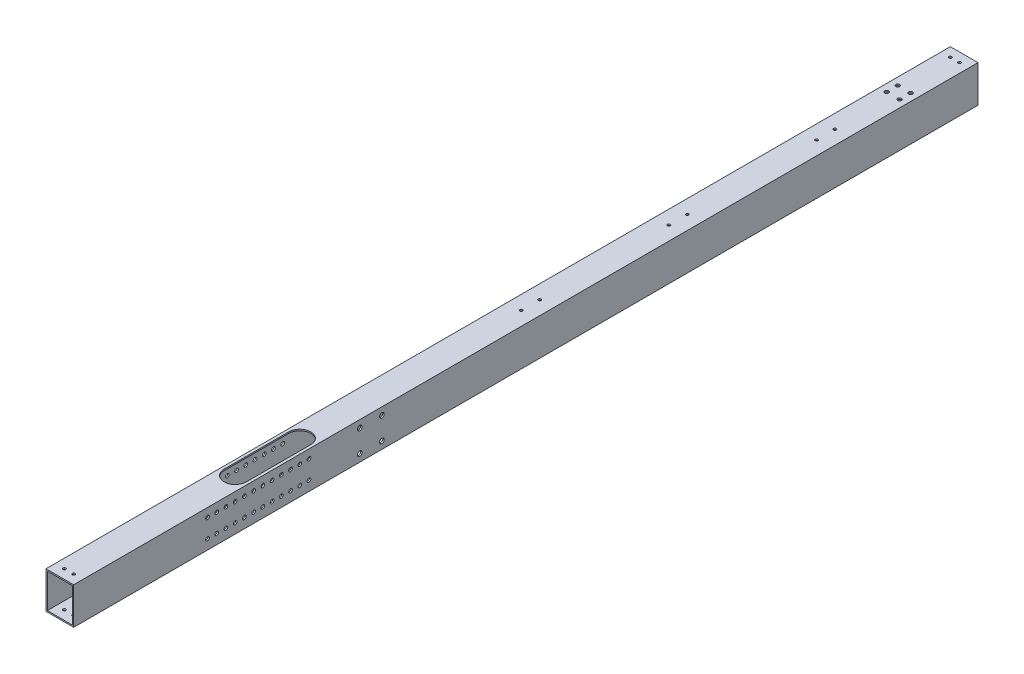
from build123d import *

# Parameters (mm, degrees)
SKETCH_1_W             = 30
SKETCH_1_H             = 40
SKETCH_1_W_2           = 27
SKETCH_1_H_2           = 37
EXTRUDE_1_DEPTH        = 980
SKETCH_3_R             = 1.5
CUT_EXTRUDE_2_DEPTH    = 981.930680527
SKETCH_4_R             = 3.25
CUT_EXTRUDE_3_DEPTH    = 21
SKETCH_5_R             = 1.5
CUT_EXTRUDE_4_DEPTH    = 981.930680527
CUT_EXTRUDE_6_DEPTH    = 10
SKETCH_9_R             = 1.6
CUT_EXTRUDE_7_DEPTH    = 10
PATTERN_LINEAR_1_COUNT = 4
PATTERN_LINEAR_1_PITCH = 13
SKETCH_10_R            = 2.55
CUT_EXTRUDE_8_DEPTH    = 51
SKETCH_11_R            = 2
CUT_EXTRUDE_9_DEPTH    = 51
SKETCH_12_R            = 2.1
CUT_EXTRUDE_10_DEPTH   = 10
CUT_EXTRUDE_11_DEPTH   = 10
CUT_EXTRUDE_12_DEPTH   = 10


with BuildPart() as part:
    # 草图1 → 凸台-拉伸1 (new body)
    with BuildSketch(Plane.XY):
        Rectangle(SKETCH_1_W, SKETCH_1_H)
        Rectangle(SKETCH_1_W_2, SKETCH_1_H_2, mode=Mode.SUBTRACT)
    extrude(amount=EXTRUDE_1_DEPTH)

    # 草图3 → 切除-拉伸2 (cut, through all)
    with BuildSketch(Plane(origin=(0, 20, 0), x_dir=(-1, 0, 0), z_dir=(0, -1, 0))):
        with Locations((5, -10)):
            Circle(SKETCH_3_R)
        with Locations((-5, -10)):
            Circle(SKETCH_3_R)
        with Locations((-5, -970)):
            Circle(SKETCH_3_R)
        with Locations((5, -970)):
            Circle(SKETCH_3_R)
    extrude(amount=CUT_EXTRUDE_2_DEPTH, mode=Mode.SUBTRACT)

    # 草图4 → 切除-拉伸3 (cut)
    with BuildSketch(Plane(origin=(0, 20, 0), x_dir=(-1, 0, 0), z_dir=(0, -1, 0))):
        with Locations((-8.27006126, -772.5)):
            Circle(SKETCH_4_R)
        with Locations((6.72993874, -772.5)):
            Circle(SKETCH_4_R)
        with Locations((6.72993874, -787.5)):
            Circle(SKETCH_4_R)
        with Locations((-8.27006126, -787.5)):
            Circle(SKETCH_4_R)
    extrude(amount=CUT_EXTRUDE_3_DEPTH, mode=Mode.SUBTRACT)

    # 草图5 → 切除-拉伸4 (cut, through all)
    with BuildSketch(Plane(origin=(0, 20, 0), x_dir=(-1, 0, 0), z_dir=(0, -1, 0))):
        with Locations((0, -140)):
            Circle(SKETCH_5_R)
        with Locations((0, -160)):
            Circle(SKETCH_5_R)
        with Locations((0, -300)):
            Circle(SKETCH_5_R)
        with Locations((0, -320)):
            Circle(SKETCH_5_R)
        with Locations((0, -480)):
            Circle(SKETCH_5_R)
        with Locations((0, -460)):
            Circle(SKETCH_5_R)
    extrude(amount=CUT_EXTRUDE_4_DEPTH, mode=Mode.SUBTRACT)

    # 草图8 → 切除-拉伸6 (cut)
    with BuildSketch(Plane.XZ.offset(20)):
        with BuildLine():
            Line((7.5, 160), (7.5, 140))
            ThreePointArc((7.5, 140), (0, 132.5), (-7.5, 140))
            Line((-7.5, 140), (-7.5, 160))
            ThreePointArc((-7.5, 160), (0, 167.5), (7.5, 160))
        make_face()
        with BuildLine():
            Line((7.5, 480), (7.5, 460))
            ThreePointArc((7.5, 460), (0, 452.5), (-7.5, 460))
            Line((-7.5, 460), (-7.5, 480))
            ThreePointArc((-7.5, 480), (0, 487.5), (7.5, 480))
        make_face()
        with BuildLine():
            Line((7.5, 320), (7.5, 300))
            ThreePointArc((7.5, 300), (0, 292.5), (-7.5, 300))
            Line((-7.5, 300), (-7.5, 320))
            ThreePointArc((-7.5, 320), (0, 327.5), (7.5, 320))
        make_face()
    extrude(amount=-CUT_EXTRUDE_6_DEPTH, mode=Mode.SUBTRACT)

    # 草图9 → 切除-拉伸7 (cut)
    with BuildSketch(Plane.XZ.offset(20)):
        with Locations((10, 787.5)):
            Circle(SKETCH_9_R)
        with Locations((10, 774.5)):
            Circle(SKETCH_9_R)
        with Locations((-10, 774.5)):
            Circle(SKETCH_9_R)
        with Locations((-10, 787.5)):
            Circle(SKETCH_9_R)
    cut_extrude_7 = extrude(amount=-CUT_EXTRUDE_7_DEPTH, mode=Mode.SUBTRACT)

    # 阵列(线性)1: 切除-拉伸7 ×4
    with Locations(*[(0, 0, -i * PATTERN_LINEAR_1_PITCH) for i in range(1, PATTERN_LINEAR_1_COUNT)]):
        add(cut_extrude_7, mode=Mode.SUBTRACT)

    # 草图10 → 切除-拉伸8 (cut)
    with BuildSketch(Plane.ZY.offset(15)):
        with Locations((646, 12)):
            Circle(SKETCH_10_R)
        with Locations((670, 12)):
            Circle(SKETCH_10_R)
        with Locations((646, -12)):
            Circle(SKETCH_10_R)
        with Locations((670, -12)):
            Circle(SKETCH_10_R)
    extrude(amount=-CUT_EXTRUDE_8_DEPTH, mode=Mode.SUBTRACT)

    # 草图11 → 切除-拉伸9 (cut)
    with BuildSketch(Plane.ZY.offset(15)):
        with Locations((725, 10.625214933)):
            Circle(SKETCH_11_R)
        with Locations((725, -9.374785067)):
            Circle(SKETCH_11_R)
        with Locations((735, 10.625214933)):
            Circle(SKETCH_11_R)
        with Locations((735, -9.374785067)):
            Circle(SKETCH_11_R)
        with Locations((745, 10.625214933)):
            Circle(SKETCH_11_R)
        with Locations((745, -9.374785067)):
            Circle(SKETCH_11_R)
        with Locations((755, 10.625214933)):
            Circle(SKETCH_11_R)
        with Locations((755, -9.374785067)):
            Circle(SKETCH_11_R)
        with Locations((765, 10.625214933)):
            Circle(SKETCH_11_R)
        with Locations((765, -9.374785067)):
            Circle(SKETCH_11_R)
        with Locations((775, 10.625214933)):
            Circle(SKETCH_11_R)
        with Locations((775, -9.374785067)):
            Circle(SKETCH_11_R)
        with Locations((785, 10.625214933)):
            Circle(SKETCH_11_R)
        with Locations((785, -9.374785067)):
            Circle(SKETCH_11_R)
        with Locations((795, 10.625214933)):
            Circle(SKETCH_11_R)
        with Locations((795, -9.374785067)):
            Circle(SKETCH_11_R)
        with Locations((805, 10.625214933)):
            Circle(SKETCH_11_R)
        with Locations((805, -9.374785067)):
            Circle(SKETCH_11_R)
        with Locations((815, 10.625214933)):
            Circle(SKETCH_11_R)
        with Locations((815, -9.374785067)):
            Circle(SKETCH_11_R)
        with Locations((825, 10.625214933)):
            Circle(SKETCH_11_R)
        with Locations((825, -9.374785067)):
            Circle(SKETCH_11_R)
        with Locations((835, 10.625214933)):
            Circle(SKETCH_11_R)
        with Locations((835, -9.374785067)):
            Circle(SKETCH_11_R)
    extrude(amount=-CUT_EXTRUDE_9_DEPTH, mode=Mode.SUBTRACT)

    # 草图12 → 切除-拉伸10 (cut)
    with BuildSketch(Plane(origin=(0, 20, 0), x_dir=(1, 0, 0), z_dir=(0, 1, 0))):
        with Locations((-7, -65)):
            Circle(SKETCH_12_R)
        with Locations((-7, -77)):
            Circle(SKETCH_12_R)
        with Locations((7, -77)):
            Circle(SKETCH_12_R)
        with Locations((7, -65)):
            Circle(SKETCH_12_R)
    extrude(amount=-CUT_EXTRUDE_10_DEPTH, mode=Mode.SUBTRACT)

    # 草图13 → 切除-拉伸11 (cut)
    with BuildSketch(Plane.XZ.offset(20)):
        with BuildLine():
            Line((-8.20885401, 70.140843723), (-8.20885401, 99.712723414))
            ThreePointArc((-8.20885401, 99.712723414), (0, 107.921577424), (8.20885401, 99.712723414))
            Line((8.20885401, 99.712723414), (8.20885401, 70.140843723))
            ThreePointArc((8.20885401, 70.140843723), (0, 61.931989713), (-8.20885401, 70.140843723))
        make_face()
    extrude(amount=-CUT_EXTRUDE_11_DEPTH, mode=Mode.SUBTRACT)

    # 草图14 → 切除-拉伸12 (cut)
    with BuildSketch(Plane(origin=(0, 20, 0), x_dir=(1, 0, 0), z_dir=(0, 1, 0))):
        with BuildLine():
            Line((12, -720), (12, -790))
            ThreePointArc((12, -790), (0, -802), (-12, -790))
            Line((-12, -790), (-12, -720))
            ThreePointArc((-12, -720), (0, -708), (12, -720))
        make_face()
    extrude(amount=-CUT_EXTRUDE_12_DEPTH, mode=Mode.SUBTRACT)


solid = part.part
